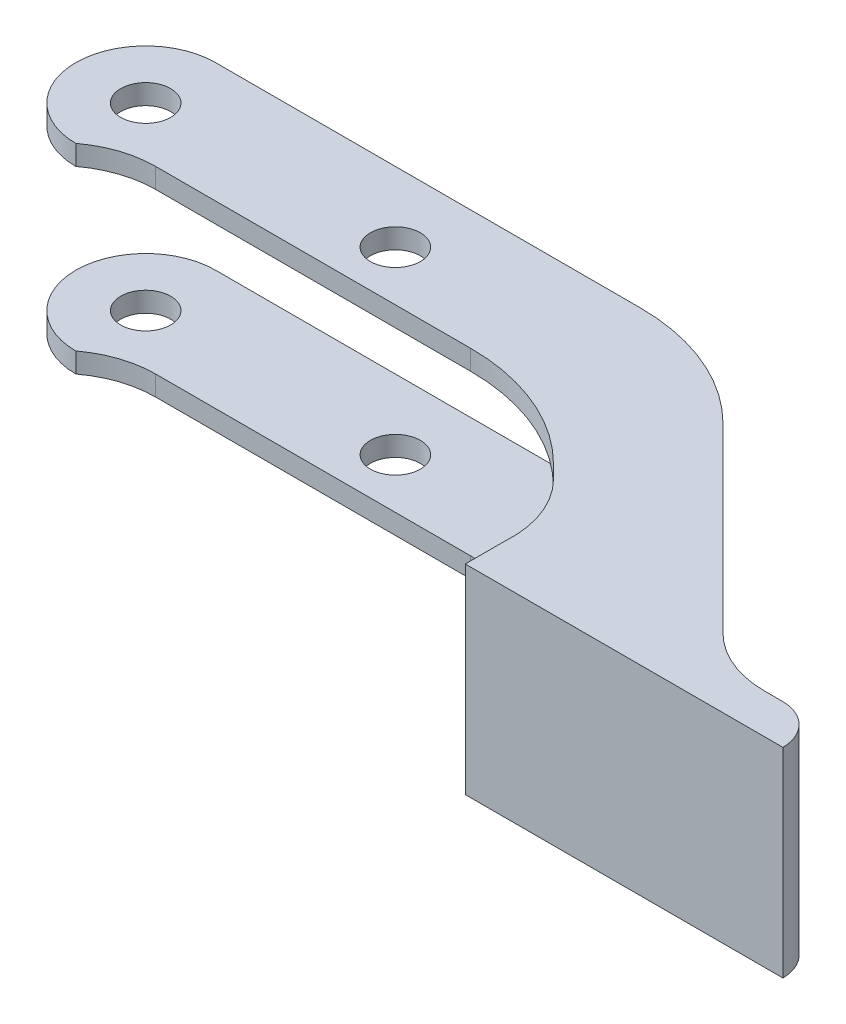
from build123d import *

# Parameters (mm, degrees)
SKETCH1_R                = 2.5
BOSS_EXTRUDE1_DEPTH      = 2
BOSS_EXTRUDE2_DEPTH      = 2
BOSS_EXTRUDE3_DEPTH      = 18
BOSS_EXTRUDE3_DEPTH_BACK = 2
SKETCH4_W                = 31.798989874
SKETCH4_H                = 3.966560298
BOSS_EXTRUDE5_START      = -2
SKETCH6_R                = 2.5
BOSS_EXTRUDE5_DEPTH      = 2
FILLET1_R                = 10
FILLET2_R                = 10
FILLET4_R                = 4
CUT_EXTRUDE1_DEPTH       = 94.156093248
SKETCH9_W                = 6.238119779
SKETCH9_H                = 1.91760407
CUT_EXTRUDE2_DEPTH       = 94.156093248
FILLET5_R                = 10
FILLET6_R                = 10
BOSS_EXTRUDE6_REACH      = 94.747
SKETCH10_R               = 3


with BuildPart() as part:
    # Sketch1 → Boss-Extrude1 (new body)
    with BuildSketch(Plane(origin=(0, 0, 0), x_dir=(1, 0, 0), z_dir=(0, 1, 0))):
        with BuildLine():
            Line((0, 7), (25, 7))
            ThreePointArc((25, 7), (32, 0), (25, -7))
            Line((25, -7), (0, -7))
            ThreePointArc((0, -7), (-7, 0), (0, 7))
        make_face()
        with Locations(Location((0, 0, 0), (0, 0, 270))):
            Circle(SKETCH1_R, mode=Mode.SUBTRACT)
        with Locations(Location((25, 0, 0), (0, 0, 270))):
            Circle(SKETCH1_R, mode=Mode.SUBTRACT)
    extrude(amount=BOSS_EXTRUDE1_DEPTH)

    # Sketch3 → Boss-Extrude2 (add)
    with BuildSketch(Plane(origin=(0, 0, 0), x_dir=(-1, 0, 0), z_dir=(0, -1, 0))):
        with BuildLine():
            Line((-25, -7), (-36.715728753, -7))
            ThreePointArc((-36.715728753, -7), (-44.3693974, -8.52240935), (-50.857864376, -12.857864376))
            Line((-50.857864376, -12.857864376), (-61.970562748, -23.970562748))
            Line((-61.970562748, -23.970562748), (-81.769552622, -23.970562748))
            Line((-81.769552622, -23.970562748), (-71.870057685, -14.071067812))
            Line((-71.870057685, -14.071067812), (-56.656854249, 1.142135624))
            ThreePointArc((-56.656854249, 1.142135624), (-50.168387273, 5.47759065), (-42.514718626, 7))
            Line((-42.514718626, 7), (-25, 7))
            ThreePointArc((-25, 7), (-32, 0), (-25, -7))
        make_face()
    boss_extrude2 = extrude(amount=-BOSS_EXTRUDE2_DEPTH)

    # Sketch4 → Boss-Extrude3 (add, two sides: drawn at the far end of the back side and taken through both)
    with BuildSketch(Plane(origin=(0, 2, 0), x_dir=(1, 0, 0), z_dir=(0, 1, 0)).offset(-BOSS_EXTRUDE3_DEPTH_BACK)):
        with Locations((71.870057685, -21.987282599)):
            Rectangle(SKETCH4_W, SKETCH4_H)
    extrude(amount=BOSS_EXTRUDE3_DEPTH + BOSS_EXTRUDE3_DEPTH_BACK)

    # Mirror1: Boss-Extrude2 across plane
    add(boss_extrude2.mirror(Plane.ZX.offset(10)))

    # Sketch6 → Boss-Extrude5 (add)
    with BuildSketch(Plane(origin=(0, 20, 0), x_dir=(1, 0, 0), z_dir=(0, 1, 0)).offset(BOSS_EXTRUDE5_START)):
        with BuildLine():
            Line((25, -7), (0, -7))
            ThreePointArc((0, -7), (-7, 0), (0, 7))
            Line((0, 7), (25, 7))
            ThreePointArc((25, 7), (32, 0), (25, -7))
        make_face()
        with Locations(Location((0, 0, 0), (0, 0, 270))):
            Circle(SKETCH6_R, mode=Mode.SUBTRACT)
        with Locations(Location((25, 0, 0), (0, 0, 270))):
            Circle(SKETCH6_R, mode=Mode.SUBTRACT)
    extrude(amount=BOSS_EXTRUDE5_DEPTH)

    # Fillet1
    # the kernel refuses this fillet: 10 mm, written as the material it adds along each edge
    with BuildSketch(Plane(origin=(58.00400245, 0, 20.00400245), x_dir=(-1, 0, 0), z_dir=(0, 1, 0)), Plane(origin=(58.00400245, 18, 20.00400245), x_dir=(-1, 0, 0), z_dir=(0, 1, 0))) as fillet1_piece_1:
        with BuildLine():
            CenterArc((11.740850866, 2.401284758), FILLET1_R, 193.894123227, 31.105876773)
            Line((4.669783054, -4.669783054), (0, 0))
            Line((0, 0), (2.033439702, 0))
        make_face()
    extrude(amount=2)
    with BuildSketch(Plane(origin=(58.00400245, -16.510176322, 20.00400245), x_dir=(-1, 0, 0), z_dir=(0, 1, 0))) as fillet1_piece_2_section:
        with BuildLine():
            CenterArc((11.740850866, 2.401284758), FILLET1_R, 193.894123227, 31.105876773)
            Line((4.669783054, -4.669783054), (0, 0))
            Line((0, 0), (2.033439702, 0))
        make_face()
    fillet1_piece_2 = extrude(amount=35.020352644, mode=Mode.PRIVATE)
    fillet1_piece_2 = split(fillet1_piece_2, bisect_by=Plane(origin=(54.988670777, 18, 17.479262968), z_dir=(0, 1, 0)), keep=Keep.TOP, mode=Mode.PRIVATE)
    add(fillet1_piece_2)
    with BuildSketch(Plane(origin=(58.00400245, 1.489823678, 20.00400245), x_dir=(-1, 0, 0), z_dir=(0, 1, 0))) as fillet1_piece_3_section:
        with BuildLine():
            CenterArc((11.740850866, 2.401284758), FILLET1_R, 193.894123227, 31.105876773)
            Line((4.669783054, -4.669783054), (0, 0))
            Line((0, 0), (2.033439702, 0))
        make_face()
    fillet1_piece_3 = extrude(amount=35.020352644, mode=Mode.PRIVATE)
    fillet1_piece_3 = split(fillet1_piece_3, bisect_by=Plane(origin=(54.988670777, 2, 17.479262968), z_dir=(0, -1, 0)), keep=Keep.TOP, mode=Mode.PRIVATE)
    add(fillet1_piece_3)

    # Fillet2
    fillet2_edges = [part.edges().sort_by_distance(p)[0] for p in [
        (77.802992324, 1, 20.00400245),
        (77.802992324, 19, 20.00400245),
    ]]
    fillet(fillet2_edges, radius=FILLET2_R)

    # Fillet4
    # the kernel refuses this fillet: 4 mm, written as the material it takes off along each edge
    with BuildSketch(Plane(origin=(87.769552622, 30, 20.00400245), x_dir=(0, 0, 1), z_dir=(0, -1, 0))) as fillet4_piece_1:
        with BuildLine():
            CenterArc((FILLET4_R, FILLET4_R), FILLET4_R, 180, 90)
            Line((0, FILLET4_R), (0, 0))
            Line((0, 0), (FILLET4_R, 0))
        make_face()
    extrude(amount=40, mode=Mode.SUBTRACT)

    # Sketch8 → Cut-Extrude1 (cut, through all)
    with BuildSketch(Plane.XZ):
        with BuildLine():
            Line((0, 5), (25, 5))
            Line((25, 5), (37.544155877, 5))
            ThreePointArc((37.544155877, 5), (45.197824525, 6.52240935), (51.686291501, 10.857864376))
            Line((51.686291501, 10.857864376), (60.832429575, 20.00400245))
            Line((60.832429575, 20.00400245), (58.00400245, 20.00400245))
            Line((58.00400245, 20.00400245), (50.528510621, 12.697308088))
            ThreePointArc((50.528510621, 12.697308088), (44.096826604, 8.479014089), (36.548775141, 7))
            Line((36.548775141, 7), (0, 7))
            Line((0, 7), (0, 5))
        make_face()
    extrude(amount=-CUT_EXTRUDE1_DEPTH, mode=Mode.SUBTRACT)

    # Sketch9 → Cut-Extrude2 (cut, through all)
    with BuildSketch(Plane.XZ):
        with Locations((54.884942561, 19.045200415)):
            Rectangle(SKETCH9_W, SKETCH9_H)
    extrude(amount=-CUT_EXTRUDE2_DEPTH, mode=Mode.SUBTRACT)


with BuildPart() as body_2:
    # of the pieces the cut leaves, the one that is kept (cut_extrude2_keep)
    add(part.part.solids().sort_by_distance((74.874060135, 2, 17.075070262))[0])

    # Fillet5
    # the kernel refuses this fillet: 10 mm, written as the material it adds along each edge
    with BuildSketch(Plane(origin=(60.832429575, -9.459016288, 20.00400245), x_dir=(-0.7071067811865474, 0, -0.7071067811865478), z_dir=(0, 1, 0))) as fillet5_piece_1_section:
        with BuildLine():
            CenterArc((10.983606515, 10), FILLET5_R, 221.011773661, 48.988226339)
            Line((3.437859002, 3.437859002), (3.286944052, 3.306616182))
            ThreePointArc((3.286944052, 3.306616182), (1.577508145, 1.860350857), (-0.141421356, 0.141421356))
            Line((-0.141421356, 0.141421356), (0, -0.2))
            Line((0, -0.2), (10.983606515, -0.2))
            Line((10.983606515, -0.2), (10.983606515, 0))
        make_face()
    fillet5_piece_1 = extrude(amount=29.459016288, mode=Mode.PRIVATE)
    fillet5_piece_1 = split(fillet5_piece_1, bisect_by=Plane(origin=(55.139630426, 2, 14.853505851), z_dir=(0, -1, 0)), keep=Keep.TOP, mode=Mode.PRIVATE)
    fillet5_piece_1 = split(fillet5_piece_1, bisect_by=Plane(origin=(55.139630426, 0, 14.853505851), z_dir=(0, 1, 0)), keep=Keep.TOP, mode=Mode.PRIVATE)
    fillet5_piece_1 = split(fillet5_piece_1, bisect_by=Plane(origin=(55.970562748, 1, 14.853505851), z_dir=(-1, 0, 0)), keep=Keep.TOP, mode=Mode.PRIVATE)
    add(fillet5_piece_1)
    with BuildSketch(Plane(origin=(60.832429575, -9.459016288, 20.00400245), x_dir=(-0.7071067811865474, 0, -0.7071067811865478), z_dir=(0, 1, 0))) as fillet5_piece_2_section:
        with BuildLine():
            CenterArc((10.983606515, 10), FILLET5_R, 221.011773661, 48.988226339)
            Line((3.437859002, 3.437859002), (3.286944052, 3.306616182))
            ThreePointArc((3.286944052, 3.306616182), (1.577508145, 1.860350857), (-0.141421356, 0.141421356))
            Line((-0.141421356, 0.141421356), (0, -0.2))
            Line((0, -0.2), (10.983606515, -0.2))
            Line((10.983606515, -0.2), (10.983606515, 0))
        make_face()
    fillet5_piece_2 = extrude(amount=29.459016288, mode=Mode.PRIVATE)
    fillet5_piece_2 = split(fillet5_piece_2, bisect_by=Plane(origin=(57.757244396, 2, 18.390577646), z_dir=(0, -1, 0)), keep=Keep.TOP, mode=Mode.PRIVATE)
    fillet5_piece_2 = split(fillet5_piece_2, bisect_by=Plane(origin=(57.757244396, 0, 18.390577646), z_dir=(0, 1, 0)), keep=Keep.TOP, mode=Mode.PRIVATE)
    fillet5_piece_2 = split(fillet5_piece_2, bisect_by=Plane(origin=(55.970562748, 1, 18.390577646), z_dir=(1, 0, 0)), keep=Keep.TOP, mode=Mode.PRIVATE)
    add(fillet5_piece_2)
    with BuildSketch(Plane(origin=(60.832429575, 18, 20.00400245), x_dir=(-0.7071067811865472, 0, -0.7071067811865479), z_dir=(0, 1, 0))) as fillet5_piece_3_section:
        with BuildLine():
            CenterArc((10.983606515, 10), FILLET5_R, 221.011773661, 48.988226339)
            Line((3.437859002, 3.437859002), (3.286944052, 3.306616182))
            ThreePointArc((3.286944052, 3.306616182), (1.577508145, 1.860350857), (-0.141421356, 0.141421356))
            Line((-0.141421356, 0.141421356), (0, -0.2))
            Line((0, -0.2), (10.983606515, -0.2))
            Line((10.983606515, -0.2), (10.983606515, 0))
        make_face()
    fillet5_piece_3 = extrude(amount=2, mode=Mode.PRIVATE)
    fillet5_piece_3 = split(fillet5_piece_3, bisect_by=Plane(origin=(55.970562748, 19, 14.853505851), z_dir=(-1, 0, 0)), keep=Keep.TOP, mode=Mode.PRIVATE)
    add(fillet5_piece_3)
    with BuildSketch(Plane(origin=(60.832429575, 18, 20.00400245), x_dir=(-0.7071067811865472, 0, -0.7071067811865479), z_dir=(0, 1, 0))) as fillet5_piece_4_section:
        with BuildLine():
            CenterArc((10.983606515, 10), FILLET5_R, 221.011773661, 48.988226339)
            Line((3.437859002, 3.437859002), (3.286944052, 3.306616182))
            ThreePointArc((3.286944052, 3.306616182), (1.577508145, 1.860350857), (-0.141421356, 0.141421356))
            Line((-0.141421356, 0.141421356), (0, -0.2))
            Line((0, -0.2), (10.983606515, -0.2))
            Line((10.983606515, -0.2), (10.983606515, 0))
        make_face()
    fillet5_piece_4 = extrude(amount=2, mode=Mode.PRIVATE)
    fillet5_piece_4 = split(fillet5_piece_4, bisect_by=Plane(origin=(55.970562748, 19, 18.390577646), z_dir=(1, 0, 0)), keep=Keep.TOP, mode=Mode.PRIVATE)
    add(fillet5_piece_4)
    with BuildSketch(Plane(origin=(60.832429575, 0, 20.00400245), x_dir=(-1, 0, 0), z_dir=(0, 1, 0))) as fillet5_piece_5_section:
        with BuildLine():
            CenterArc((14.837650461, -0.695514837), FILLET5_R, 176.011773661, 48.988226339)
            Line((7.766582649, -7.766582649), (7.625161292, -7.908004005))
            Line((7.625161292, -7.908004005), (-0.141421356, -0.141421356))
            Line((-0.141421356, -0.141421356), (0, 0.2))
            ThreePointArc((0, 0.2), (2.430933413, 0.2), (4.662351154, 0.013910297))
            Line((4.662351154, 0.013910297), (4.861866827, 0))
        make_face()
    fillet5_piece_5 = extrude(amount=2, mode=Mode.PRIVATE)
    fillet5_piece_5 = split(fillet5_piece_5, bisect_by=Plane(origin=(55.970562748, 1, 18.390577646), z_dir=(1, 0, 0)), keep=Keep.TOP, mode=Mode.PRIVATE)
    add(fillet5_piece_5)
    with BuildSketch(Plane(origin=(60.832429575, 0, 20.00400245), x_dir=(-1, 0, 0), z_dir=(0, 1, 0))) as fillet5_piece_6_section:
        with BuildLine():
            CenterArc((14.837650461, -0.695514837), FILLET5_R, 176.011773661, 48.988226339)
            Line((7.766582649, -7.766582649), (7.625161292, -7.908004005))
            Line((7.625161292, -7.908004005), (-0.141421356, -0.141421356))
            Line((-0.141421356, -0.141421356), (0, 0.2))
            ThreePointArc((0, 0.2), (2.430933413, 0.2), (4.662351154, 0.013910297))
            Line((4.662351154, 0.013910297), (4.861866827, 0))
        make_face()
    fillet5_piece_6 = extrude(amount=2, mode=Mode.PRIVATE)
    fillet5_piece_6 = split(fillet5_piece_6, bisect_by=Plane(origin=(55.970562748, 1, 14.853505851), z_dir=(-1, 0, 0)), keep=Keep.TOP, mode=Mode.PRIVATE)
    add(fillet5_piece_6)
    with BuildSketch(Plane(origin=(60.832429575, 0, 20.00400245), x_dir=(-1, 0, 0), z_dir=(0, 1, 0))) as fillet5_piece_7_section:
        with BuildLine():
            CenterArc((14.837650461, -0.695514837), FILLET5_R, 176.011773661, 48.988226339)
            Line((7.766582649, -7.766582649), (7.625161292, -7.908004005))
            Line((7.625161292, -7.908004005), (-0.141421356, -0.141421356))
            Line((-0.141421356, -0.141421356), (0, 0.2))
            ThreePointArc((0, 0.2), (2.430933413, 0.2), (4.662351154, 0.013910297))
            Line((4.662351154, 0.013910297), (4.861866827, 0))
        make_face()
    fillet5_piece_7 = extrude(amount=29.459016288, mode=Mode.PRIVATE)
    fillet5_piece_7 = split(fillet5_piece_7, bisect_by=Plane(origin=(55.970562748, 19, 18.390577646), z_dir=(1, 0, 0)), keep=Keep.TOP, mode=Mode.PRIVATE)
    fillet5_piece_7 = split(fillet5_piece_7, bisect_by=Plane(origin=(57.757244396, 20, 18.390577646), z_dir=(0, -1, 0)), keep=Keep.TOP, mode=Mode.PRIVATE)
    fillet5_piece_7 = split(fillet5_piece_7, bisect_by=Plane(origin=(57.757244396, 18, 18.390577646), z_dir=(0, 1, 0)), keep=Keep.TOP, mode=Mode.PRIVATE)
    add(fillet5_piece_7)
    with BuildSketch(Plane(origin=(60.832429575, 0, 20.00400245), x_dir=(-1, 0, 0), z_dir=(0, 1, 0))) as fillet5_piece_8_section:
        with BuildLine():
            CenterArc((14.837650461, -0.695514837), FILLET5_R, 176.011773661, 48.988226339)
            Line((7.766582649, -7.766582649), (7.625161292, -7.908004005))
            Line((7.625161292, -7.908004005), (-0.141421356, -0.141421356))
            Line((-0.141421356, -0.141421356), (0, 0.2))
            ThreePointArc((0, 0.2), (2.430933413, 0.2), (4.662351154, 0.013910297))
            Line((4.662351154, 0.013910297), (4.861866827, 0))
        make_face()
    fillet5_piece_8 = extrude(amount=29.459016288, mode=Mode.PRIVATE)
    fillet5_piece_8 = split(fillet5_piece_8, bisect_by=Plane(origin=(55.970562748, 19, 14.853505851), z_dir=(-1, 0, 0)), keep=Keep.TOP, mode=Mode.PRIVATE)
    fillet5_piece_8 = split(fillet5_piece_8, bisect_by=Plane(origin=(55.139630426, 20, 14.853505851), z_dir=(0, -1, 0)), keep=Keep.TOP, mode=Mode.PRIVATE)
    fillet5_piece_8 = split(fillet5_piece_8, bisect_by=Plane(origin=(55.139630426, 18, 14.853505851), z_dir=(0, 1, 0)), keep=Keep.TOP, mode=Mode.PRIVATE)
    add(fillet5_piece_8)

    # Fillet6
    # the kernel refuses this fillet: 10 mm, written as the material it adds along each edge
    with BuildSketch(Plane(origin=(0, 18, 5), x_dir=(1, 0, 0), z_dir=(0, 1, 0))) as fillet6_piece_1:
        with BuildLine():
            CenterArc((6, -10), FILLET6_R, 90, 36.869897646)
            Line((0, -2), (-0.12, -1.84))
            ThreePointArc((-0.12, -1.84), (-0.2, -1), (-0.2, 0))
            Line((-0.2, 0), (0, 0.2))
            Line((0, 0.2), (6, 0.2))
            Line((6, 0.2), (6, 0))
        make_face()
    extrude(amount=2)
    with BuildSketch(Plane(origin=(0, 0, 5), x_dir=(0, 0, 1), z_dir=(0, 1, 0))) as fillet6_piece_2:
        with BuildLine():
            CenterArc((10, 6), FILLET6_R, 180, 36.869897646)
            Line((0, 6), (-0.2, 6))
            Line((-0.2, 6), (-0.2, 0))
            Line((-0.2, 0), (0, -0.2))
            ThreePointArc((0, -0.2), (1, -0.2), (1.84, -0.12))
            Line((1.84, -0.12), (2, 0))
        make_face()
    extrude(amount=2)

    # Sketch10 → Boss-Extrude6 (add, up to next)
    with BuildSketch(Plane(origin=(0, 2, 0), x_dir=(1, 0, 0), z_dir=(0, 1, 0)), mode=Mode.PRIVATE) as boss_extrude6_sk1:
        with Locations(Location((46.159136263, 0, 0), (0, 0, 270))):
            Circle(SKETCH10_R)
    boss_extrude6_tool1 = extrude(boss_extrude6_sk1.sketch, amount=BOSS_EXTRUDE6_REACH, mode=Mode.PRIVATE) - body_2.part
    add(boss_extrude6_tool1.solids().sort_by_distance((46.159136, 2, 0))[0])


solid = body_2.part
